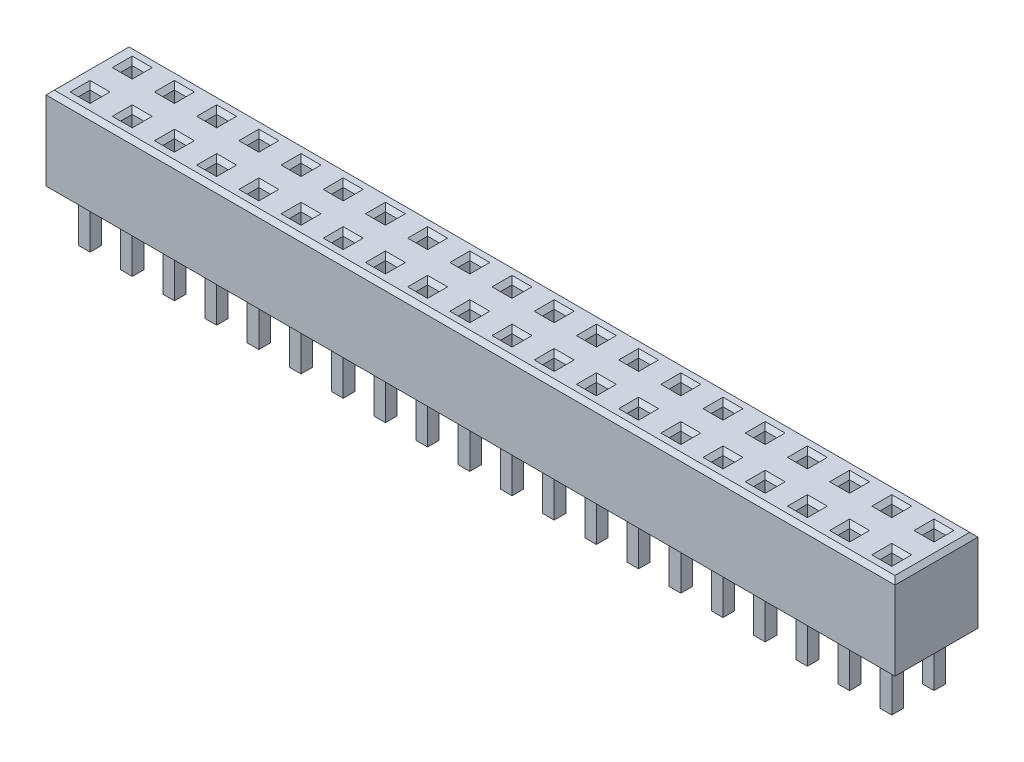
from build123d import *

# Parameters (mm, degrees)
BOSS_EXTRUDE1_DEPTH      = 2.5
BOSS_EXTRUDE1_DEPTH_BACK = 2.5
SKETCH1_W                = 51.1
SKETCH1_H                = 5
SKETCH1_W_2              = 0.7
SKETCH1_H_2              = 0.7
SKETCH2_W                = 0.7
SKETCH2_H                = 0.7
BOSS_EXTRUDE2_DEPTH      = 5.5
BOSS_EXTRUDE2_2_DEPTH    = 5.5
BOSS_EXTRUDE2_3_DEPTH    = 5.5
BOSS_EXTRUDE2_4_DEPTH    = 5.5
BOSS_EXTRUDE2_5_DEPTH    = 5.5
BOSS_EXTRUDE2_6_DEPTH    = 5.5
BOSS_EXTRUDE2_7_DEPTH    = 5.5
BOSS_EXTRUDE2_8_DEPTH    = 5.5
BOSS_EXTRUDE2_9_DEPTH    = 5.5
BOSS_EXTRUDE2_10_DEPTH   = 5.5
BOSS_EXTRUDE2_11_DEPTH   = 5.5
BOSS_EXTRUDE2_12_DEPTH   = 5.5
BOSS_EXTRUDE2_13_DEPTH   = 5.5
BOSS_EXTRUDE2_14_DEPTH   = 5.5
BOSS_EXTRUDE2_15_DEPTH   = 5.5
BOSS_EXTRUDE2_16_DEPTH   = 5.5
BOSS_EXTRUDE2_17_DEPTH   = 5.5
BOSS_EXTRUDE2_18_DEPTH   = 5.5
BOSS_EXTRUDE2_19_DEPTH   = 5.5
BOSS_EXTRUDE2_20_DEPTH   = 5.5
BOSS_EXTRUDE2_21_DEPTH   = 5.5
BOSS_EXTRUDE2_22_DEPTH   = 5.5
BOSS_EXTRUDE2_23_DEPTH   = 5.5
BOSS_EXTRUDE2_24_DEPTH   = 5.5
BOSS_EXTRUDE2_25_DEPTH   = 5.5
BOSS_EXTRUDE2_26_DEPTH   = 5.5
BOSS_EXTRUDE2_27_DEPTH   = 5.5
BOSS_EXTRUDE2_28_DEPTH   = 5.5
BOSS_EXTRUDE2_29_DEPTH   = 5.5
BOSS_EXTRUDE2_30_DEPTH   = 5.5
BOSS_EXTRUDE2_31_DEPTH   = 5.5
BOSS_EXTRUDE2_32_DEPTH   = 5.5
BOSS_EXTRUDE2_33_DEPTH   = 5.5
BOSS_EXTRUDE2_34_DEPTH   = 5.5
BOSS_EXTRUDE2_35_DEPTH   = 5.5
BOSS_EXTRUDE2_36_DEPTH   = 5.5
BOSS_EXTRUDE2_37_DEPTH   = 5.5
BOSS_EXTRUDE2_38_DEPTH   = 5.5
BOSS_EXTRUDE2_39_DEPTH   = 5.5
BOSS_EXTRUDE2_40_DEPTH   = 5.5
CHAMFER2_SIZE            = 0.25


with BuildPart() as part:
    # Sketch1 → Boss-Extrude1 (new, two sides: drawn at the far end of the back side and taken through both)
    with BuildSketch(Plane(origin=(0, 0, 0), x_dir=(1, 0, 0), z_dir=(0, 1, 0)).offset(-BOSS_EXTRUDE1_DEPTH_BACK)):
        Rectangle(SKETCH1_W, SKETCH1_H)
        with Locations((-24.13, 1.27)):
            Rectangle(SKETCH1_W_2, SKETCH1_H_2, mode=Mode.SUBTRACT)
        with Locations((-24.13, -1.27)):
            Rectangle(SKETCH1_W_2, SKETCH1_H_2, mode=Mode.SUBTRACT)
        with Locations((-21.59, 1.27)):
            Rectangle(SKETCH1_W_2, SKETCH1_H_2, mode=Mode.SUBTRACT)
        with Locations((-21.59, -1.27)):
            Rectangle(SKETCH1_W_2, SKETCH1_H_2, mode=Mode.SUBTRACT)
        with Locations((-19.05, 1.27)):
            Rectangle(SKETCH1_W_2, SKETCH1_H_2, mode=Mode.SUBTRACT)
        with Locations((-19.05, -1.27)):
            Rectangle(SKETCH1_W_2, SKETCH1_H_2, mode=Mode.SUBTRACT)
        with Locations((-16.51, 1.27)):
            Rectangle(SKETCH1_W_2, SKETCH1_H_2, mode=Mode.SUBTRACT)
        with Locations((-16.51, -1.27)):
            Rectangle(SKETCH1_W_2, SKETCH1_H_2, mode=Mode.SUBTRACT)
        with Locations((-13.97, 1.27)):
            Rectangle(SKETCH1_W_2, SKETCH1_H_2, mode=Mode.SUBTRACT)
        with Locations((-13.97, -1.27)):
            Rectangle(SKETCH1_W_2, SKETCH1_H_2, mode=Mode.SUBTRACT)
        with Locations((-11.43, 1.27)):
            Rectangle(SKETCH1_W_2, SKETCH1_H_2, mode=Mode.SUBTRACT)
        with Locations((-11.43, -1.27)):
            Rectangle(SKETCH1_W_2, SKETCH1_H_2, mode=Mode.SUBTRACT)
        with Locations((-8.89, 1.27)):
            Rectangle(SKETCH1_W_2, SKETCH1_H_2, mode=Mode.SUBTRACT)
        with Locations((-8.89, -1.27)):
            Rectangle(SKETCH1_W_2, SKETCH1_H_2, mode=Mode.SUBTRACT)
        with Locations((-6.35, 1.27)):
            Rectangle(SKETCH1_W_2, SKETCH1_H_2, mode=Mode.SUBTRACT)
        with Locations((-6.35, -1.27)):
            Rectangle(SKETCH1_W_2, SKETCH1_H_2, mode=Mode.SUBTRACT)
        with Locations((-3.81, 1.27)):
            Rectangle(SKETCH1_W_2, SKETCH1_H_2, mode=Mode.SUBTRACT)
        with Locations((-3.81, -1.27)):
            Rectangle(SKETCH1_W_2, SKETCH1_H_2, mode=Mode.SUBTRACT)
        with Locations((-1.27, 1.27)):
            Rectangle(SKETCH1_W_2, SKETCH1_H_2, mode=Mode.SUBTRACT)
        with Locations((-1.27, -1.27)):
            Rectangle(SKETCH1_W_2, SKETCH1_H_2, mode=Mode.SUBTRACT)
        with Locations((1.27, 1.27)):
            Rectangle(SKETCH1_W_2, SKETCH1_H_2, mode=Mode.SUBTRACT)
        with Locations((1.27, -1.27)):
            Rectangle(SKETCH1_W_2, SKETCH1_H_2, mode=Mode.SUBTRACT)
        with Locations((3.81, 1.27)):
            Rectangle(SKETCH1_W_2, SKETCH1_H_2, mode=Mode.SUBTRACT)
        with Locations((3.81, -1.27)):
            Rectangle(SKETCH1_W_2, SKETCH1_H_2, mode=Mode.SUBTRACT)
        with Locations((6.35, 1.27)):
            Rectangle(SKETCH1_W_2, SKETCH1_H_2, mode=Mode.SUBTRACT)
        with Locations((6.35, -1.27)):
            Rectangle(SKETCH1_W_2, SKETCH1_H_2, mode=Mode.SUBTRACT)
        with Locations((8.89, 1.27)):
            Rectangle(SKETCH1_W_2, SKETCH1_H_2, mode=Mode.SUBTRACT)
        with Locations((8.89, -1.27)):
            Rectangle(SKETCH1_W_2, SKETCH1_H_2, mode=Mode.SUBTRACT)
        with Locations((11.43, 1.27)):
            Rectangle(SKETCH1_W_2, SKETCH1_H_2, mode=Mode.SUBTRACT)
        with Locations((11.43, -1.27)):
            Rectangle(SKETCH1_W_2, SKETCH1_H_2, mode=Mode.SUBTRACT)
        with Locations((13.97, 1.27)):
            Rectangle(SKETCH1_W_2, SKETCH1_H_2, mode=Mode.SUBTRACT)
        with Locations((13.97, -1.27)):
            Rectangle(SKETCH1_W_2, SKETCH1_H_2, mode=Mode.SUBTRACT)
        with Locations((16.51, 1.27)):
            Rectangle(SKETCH1_W_2, SKETCH1_H_2, mode=Mode.SUBTRACT)
        with Locations((16.51, -1.27)):
            Rectangle(SKETCH1_W_2, SKETCH1_H_2, mode=Mode.SUBTRACT)
        with Locations((19.05, 1.27)):
            Rectangle(SKETCH1_W_2, SKETCH1_H_2, mode=Mode.SUBTRACT)
        with Locations((19.05, -1.27)):
            Rectangle(SKETCH1_W_2, SKETCH1_H_2, mode=Mode.SUBTRACT)
        with Locations((21.59, 1.27)):
            Rectangle(SKETCH1_W_2, SKETCH1_H_2, mode=Mode.SUBTRACT)
        with Locations((21.59, -1.27)):
            Rectangle(SKETCH1_W_2, SKETCH1_H_2, mode=Mode.SUBTRACT)
        with Locations((24.13, 1.27)):
            Rectangle(SKETCH1_W_2, SKETCH1_H_2, mode=Mode.SUBTRACT)
        with Locations((24.13, -1.27)):
            Rectangle(SKETCH1_W_2, SKETCH1_H_2, mode=Mode.SUBTRACT)
    extrude(amount=BOSS_EXTRUDE1_DEPTH + BOSS_EXTRUDE1_DEPTH_BACK)

    # Chamfer2
    chamfer2_edges = [part.edges().sort_by_distance(p)[0] for p in [
        (24.13, 2.5, 0.92),
        (23.78, 2.5, 1.27),
        (24.13, 2.5, 1.62),
        (24.48, 2.5, 1.27),
        (21.59, 2.5, 0.92),
        (21.24, 2.5, 1.27),
        (21.59, 2.5, 1.62),
        (21.94, 2.5, 1.27),
        (19.05, 2.5, 0.92),
        (18.7, 2.5, 1.27),
        (19.05, 2.5, 1.62),
        (19.4, 2.5, 1.27),
        (16.51, 2.5, 0.92),
        (16.16, 2.5, 1.27),
        (16.51, 2.5, 1.62),
        (16.86, 2.5, 1.27),
        (13.97, 2.5, 0.92),
        (13.62, 2.5, 1.27),
        (13.97, 2.5, 1.62),
        (14.32, 2.5, 1.27),
        (11.43, 2.5, 0.92),
        (11.08, 2.5, 1.27),
        (11.43, 2.5, 1.62),
        (11.78, 2.5, 1.27),
        (8.89, 2.5, 0.92),
        (8.54, 2.5, 1.27),
        (8.89, 2.5, 1.62),
        (9.24, 2.5, 1.27),
        (6.35, 2.5, 0.92),
        (6, 2.5, 1.27),
        (6.35, 2.5, 1.62),
        (6.7, 2.5, 1.27),
        (3.81, 2.5, 0.92),
        (3.46, 2.5, 1.27),
        (3.81, 2.5, 1.62),
        (4.16, 2.5, 1.27),
        (1.27, 2.5, 0.92),
        (0.92, 2.5, 1.27),
        (1.27, 2.5, 1.62),
        (1.62, 2.5, 1.27),
        (-1.27, 2.5, 0.92),
        (-1.62, 2.5, 1.27),
        (-1.27, 2.5, 1.62),
        (-0.92, 2.5, 1.27),
        (-3.81, 2.5, 0.92),
        (-4.16, 2.5, 1.27),
        (-3.81, 2.5, 1.62),
        (-3.46, 2.5, 1.27),
        (-6.35, 2.5, 0.92),
        (-6.7, 2.5, 1.27),
        (-6.35, 2.5, 1.62),
        (-6, 2.5, 1.27),
        (-8.89, 2.5, 0.92),
        (-9.24, 2.5, 1.27),
        (-8.89, 2.5, 1.62),
        (-8.54, 2.5, 1.27),
        (-11.43, 2.5, 0.92),
        (-11.78, 2.5, 1.27),
        (-11.43, 2.5, 1.62),
        (-11.08, 2.5, 1.27),
        (-13.97, 2.5, 0.92),
        (-14.32, 2.5, 1.27),
        (-13.97, 2.5, 1.62),
        (-13.62, 2.5, 1.27),
        (-16.51, 2.5, 0.92),
        (-16.86, 2.5, 1.27),
        (-16.51, 2.5, 1.62),
        (-16.16, 2.5, 1.27),
        (-19.05, 2.5, 0.92),
        (-19.4, 2.5, 1.27),
        (-19.05, 2.5, 1.62),
        (-18.7, 2.5, 1.27),
        (-21.59, 2.5, 0.92),
        (-21.94, 2.5, 1.27),
        (-21.59, 2.5, 1.62),
        (-21.24, 2.5, 1.27),
        (-24.13, 2.5, 0.92),
        (-24.48, 2.5, 1.27),
        (-24.13, 2.5, 1.62),
        (-23.78, 2.5, 1.27),
        (0, 2.5, 2.5),
        (-25.55, 2.5, 0),
        (0, 2.5, -2.5),
        (25.55, 2.5, 0),
        (-24.13, 2.5, -1.62),
        (-24.48, 2.5, -1.27),
        (-24.13, 2.5, -0.92),
        (-23.78, 2.5, -1.27),
        (-21.24, 2.5, -1.27),
        (-21.59, 2.5, -1.62),
        (-21.94, 2.5, -1.27),
        (-21.59, 2.5, -0.92),
        (-18.7, 2.5, -1.27),
        (-19.05, 2.5, -1.62),
        (-19.4, 2.5, -1.27),
        (-19.05, 2.5, -0.92),
        (-16.16, 2.5, -1.27),
        (-16.51, 2.5, -1.62),
        (-16.86, 2.5, -1.27),
        (-16.51, 2.5, -0.92),
        (-13.62, 2.5, -1.27),
        (-13.97, 2.5, -1.62),
        (-14.32, 2.5, -1.27),
        (-13.97, 2.5, -0.92),
        (-11.08, 2.5, -1.27),
        (-11.43, 2.5, -1.62),
        (-11.78, 2.5, -1.27),
        (-11.43, 2.5, -0.92),
        (-8.54, 2.5, -1.27),
        (-8.89, 2.5, -1.62),
        (-9.24, 2.5, -1.27),
        (-8.89, 2.5, -0.92),
        (-6, 2.5, -1.27),
        (-6.35, 2.5, -1.62),
        (-6.7, 2.5, -1.27),
        (-6.35, 2.5, -0.92),
        (-3.46, 2.5, -1.27),
        (-3.81, 2.5, -1.62),
        (-4.16, 2.5, -1.27),
        (-3.81, 2.5, -0.92),
        (-0.92, 2.5, -1.27),
        (-1.27, 2.5, -1.62),
        (-1.62, 2.5, -1.27),
        (-1.27, 2.5, -0.92),
        (1.62, 2.5, -1.27),
        (1.27, 2.5, -1.62),
        (0.92, 2.5, -1.27),
        (1.27, 2.5, -0.92),
        (4.16, 2.5, -1.27),
        (3.81, 2.5, -1.62),
        (3.46, 2.5, -1.27),
        (3.81, 2.5, -0.92),
        (6.7, 2.5, -1.27),
        (6.35, 2.5, -1.62),
        (6, 2.5, -1.27),
        (6.35, 2.5, -0.92),
        (9.24, 2.5, -1.27),
        (8.89, 2.5, -1.62),
        (8.54, 2.5, -1.27),
        (8.89, 2.5, -0.92),
        (11.78, 2.5, -1.27),
        (11.43, 2.5, -1.62),
        (11.08, 2.5, -1.27),
        (11.43, 2.5, -0.92),
        (14.32, 2.5, -1.27),
        (13.97, 2.5, -1.62),
        (13.62, 2.5, -1.27),
        (13.97, 2.5, -0.92),
        (16.86, 2.5, -1.27),
        (16.51, 2.5, -1.62),
        (16.16, 2.5, -1.27),
        (16.51, 2.5, -0.92),
        (19.4, 2.5, -1.27),
        (19.05, 2.5, -1.62),
        (18.7, 2.5, -1.27),
        (19.05, 2.5, -0.92),
        (21.94, 2.5, -1.27),
        (21.59, 2.5, -1.62),
        (21.24, 2.5, -1.27),
        (21.59, 2.5, -0.92),
        (24.48, 2.5, -1.27),
        (24.13, 2.5, -1.62),
        (23.78, 2.5, -1.27),
        (24.13, 2.5, -0.92),
    ]]
    chamfer(chamfer2_edges, length=CHAMFER2_SIZE)


with BuildPart() as body_2:
    # Sketch2 → Boss-Extrude2 (new body)
    with BuildSketch(Plane(origin=(0, 0, 0), x_dir=(1, 0, 0), z_dir=(0, 1, 0))):
        with Locations((-21.59, 1.27)):
            Rectangle(SKETCH2_W, SKETCH2_H)
    extrude(amount=-BOSS_EXTRUDE2_DEPTH)


with BuildPart() as body_3:
    # Sketch2 → Boss-Extrude2 2 (new body)
    with BuildSketch(Plane(origin=(0, 0, 0), x_dir=(1, 0, 0), z_dir=(0, 1, 0))):
        with Locations((-24.13, 1.27)):
            Rectangle(SKETCH2_W, SKETCH2_H)
    extrude(amount=-BOSS_EXTRUDE2_2_DEPTH)


with BuildPart() as body_4:
    # Sketch2 → Boss-Extrude2 3 (new body)
    with BuildSketch(Plane(origin=(0, 0, 0), x_dir=(1, 0, 0), z_dir=(0, 1, 0))):
        with Locations((-19.05, 1.27)):
            Rectangle(SKETCH2_W, SKETCH2_H)
    extrude(amount=-BOSS_EXTRUDE2_3_DEPTH)


with BuildPart() as body_5:
    # Sketch2 → Boss-Extrude2 4 (new body)
    with BuildSketch(Plane(origin=(0, 0, 0), x_dir=(1, 0, 0), z_dir=(0, 1, 0))):
        with Locations((-16.51, 1.27)):
            Rectangle(SKETCH2_W, SKETCH2_H)
    extrude(amount=-BOSS_EXTRUDE2_4_DEPTH)


with BuildPart() as body_6:
    # Sketch2 → Boss-Extrude2 5 (new body)
    with BuildSketch(Plane(origin=(0, 0, 0), x_dir=(1, 0, 0), z_dir=(0, 1, 0))):
        with Locations((-13.97, 1.27)):
            Rectangle(SKETCH2_W, SKETCH2_H)
    extrude(amount=-BOSS_EXTRUDE2_5_DEPTH)


with BuildPart() as body_7:
    # Sketch2 → Boss-Extrude2 6 (new body)
    with BuildSketch(Plane(origin=(0, 0, 0), x_dir=(1, 0, 0), z_dir=(0, 1, 0))):
        with Locations((-11.43, 1.27)):
            Rectangle(SKETCH2_W, SKETCH2_H)
    extrude(amount=-BOSS_EXTRUDE2_6_DEPTH)


with BuildPart() as body_8:
    # Sketch2 → Boss-Extrude2 7 (new body)
    with BuildSketch(Plane(origin=(0, 0, 0), x_dir=(1, 0, 0), z_dir=(0, 1, 0))):
        with Locations((-8.89, 1.27)):
            Rectangle(SKETCH2_W, SKETCH2_H)
    extrude(amount=-BOSS_EXTRUDE2_7_DEPTH)


with BuildPart() as body_9:
    # Sketch2 → Boss-Extrude2 8 (new body)
    with BuildSketch(Plane(origin=(0, 0, 0), x_dir=(1, 0, 0), z_dir=(0, 1, 0))):
        with Locations((-6.35, 1.27)):
            Rectangle(SKETCH2_W, SKETCH2_H)
    extrude(amount=-BOSS_EXTRUDE2_8_DEPTH)


with BuildPart() as body_10:
    # Sketch2 → Boss-Extrude2 9 (new body)
    with BuildSketch(Plane(origin=(0, 0, 0), x_dir=(1, 0, 0), z_dir=(0, 1, 0))):
        with Locations((-3.81, 1.27)):
            Rectangle(SKETCH2_W, SKETCH2_H)
    extrude(amount=-BOSS_EXTRUDE2_9_DEPTH)


with BuildPart() as body_11:
    # Sketch2 → Boss-Extrude2 10 (new body)
    with BuildSketch(Plane(origin=(0, 0, 0), x_dir=(1, 0, 0), z_dir=(0, 1, 0))):
        with Locations((-1.27, 1.27)):
            Rectangle(SKETCH2_W, SKETCH2_H)
    extrude(amount=-BOSS_EXTRUDE2_10_DEPTH)


with BuildPart() as body_12:
    # Sketch2 → Boss-Extrude2 11 (new body)
    with BuildSketch(Plane(origin=(0, 0, 0), x_dir=(1, 0, 0), z_dir=(0, 1, 0))):
        with Locations((1.27, 1.27)):
            Rectangle(SKETCH2_W, SKETCH2_H)
    extrude(amount=-BOSS_EXTRUDE2_11_DEPTH)


with BuildPart() as body_13:
    # Sketch2 → Boss-Extrude2 12 (new body)
    with BuildSketch(Plane(origin=(0, 0, 0), x_dir=(1, 0, 0), z_dir=(0, 1, 0))):
        with Locations((3.81, 1.27)):
            Rectangle(SKETCH2_W, SKETCH2_H)
    extrude(amount=-BOSS_EXTRUDE2_12_DEPTH)


with BuildPart() as body_14:
    # Sketch2 → Boss-Extrude2 13 (new body)
    with BuildSketch(Plane(origin=(0, 0, 0), x_dir=(1, 0, 0), z_dir=(0, 1, 0))):
        with Locations((6.35, 1.27)):
            Rectangle(SKETCH2_W, SKETCH2_H)
    extrude(amount=-BOSS_EXTRUDE2_13_DEPTH)


with BuildPart() as body_15:
    # Sketch2 → Boss-Extrude2 14 (new body)
    with BuildSketch(Plane(origin=(0, 0, 0), x_dir=(1, 0, 0), z_dir=(0, 1, 0))):
        with Locations((8.89, 1.27)):
            Rectangle(SKETCH2_W, SKETCH2_H)
    extrude(amount=-BOSS_EXTRUDE2_14_DEPTH)


with BuildPart() as body_16:
    # Sketch2 → Boss-Extrude2 15 (new body)
    with BuildSketch(Plane(origin=(0, 0, 0), x_dir=(1, 0, 0), z_dir=(0, 1, 0))):
        with Locations((11.43, 1.27)):
            Rectangle(SKETCH2_W, SKETCH2_H)
    extrude(amount=-BOSS_EXTRUDE2_15_DEPTH)


with BuildPart() as body_17:
    # Sketch2 → Boss-Extrude2 16 (new body)
    with BuildSketch(Plane(origin=(0, 0, 0), x_dir=(1, 0, 0), z_dir=(0, 1, 0))):
        with Locations((13.97, 1.27)):
            Rectangle(SKETCH2_W, SKETCH2_H)
    extrude(amount=-BOSS_EXTRUDE2_16_DEPTH)


with BuildPart() as body_18:
    # Sketch2 → Boss-Extrude2 17 (new body)
    with BuildSketch(Plane(origin=(0, 0, 0), x_dir=(1, 0, 0), z_dir=(0, 1, 0))):
        with Locations((16.51, 1.27)):
            Rectangle(SKETCH2_W, SKETCH2_H)
    extrude(amount=-BOSS_EXTRUDE2_17_DEPTH)


with BuildPart() as body_19:
    # Sketch2 → Boss-Extrude2 18 (new body)
    with BuildSketch(Plane(origin=(0, 0, 0), x_dir=(1, 0, 0), z_dir=(0, 1, 0))):
        with Locations((19.05, 1.27)):
            Rectangle(SKETCH2_W, SKETCH2_H)
    extrude(amount=-BOSS_EXTRUDE2_18_DEPTH)


with BuildPart() as body_20:
    # Sketch2 → Boss-Extrude2 19 (new body)
    with BuildSketch(Plane(origin=(0, 0, 0), x_dir=(1, 0, 0), z_dir=(0, 1, 0))):
        with Locations((21.59, 1.27)):
            Rectangle(SKETCH2_W, SKETCH2_H)
    extrude(amount=-BOSS_EXTRUDE2_19_DEPTH)


with BuildPart() as body_21:
    # Sketch2 → Boss-Extrude2 20 (new body)
    with BuildSketch(Plane(origin=(0, 0, 0), x_dir=(1, 0, 0), z_dir=(0, 1, 0))):
        with Locations((24.13, 1.27)):
            Rectangle(SKETCH2_W, SKETCH2_H)
    extrude(amount=-BOSS_EXTRUDE2_20_DEPTH)


with BuildPart() as body_22:
    # Sketch2 → Boss-Extrude2 21 (new body)
    with BuildSketch(Plane(origin=(0, 0, 0), x_dir=(1, 0, 0), z_dir=(0, 1, 0))):
        with Locations((-21.59, -1.27)):
            Rectangle(SKETCH2_W, SKETCH2_H)
    extrude(amount=-BOSS_EXTRUDE2_21_DEPTH)


with BuildPart() as body_23:
    # Sketch2 → Boss-Extrude2 22 (new body)
    with BuildSketch(Plane(origin=(0, 0, 0), x_dir=(1, 0, 0), z_dir=(0, 1, 0))):
        with Locations((-19.05, -1.27)):
            Rectangle(SKETCH2_W, SKETCH2_H)
    extrude(amount=-BOSS_EXTRUDE2_22_DEPTH)


with BuildPart() as body_24:
    # Sketch2 → Boss-Extrude2 23 (new body)
    with BuildSketch(Plane(origin=(0, 0, 0), x_dir=(1, 0, 0), z_dir=(0, 1, 0))):
        with Locations((-16.51, -1.27)):
            Rectangle(SKETCH2_W, SKETCH2_H)
    extrude(amount=-BOSS_EXTRUDE2_23_DEPTH)


with BuildPart() as body_25:
    # Sketch2 → Boss-Extrude2 24 (new body)
    with BuildSketch(Plane(origin=(0, 0, 0), x_dir=(1, 0, 0), z_dir=(0, 1, 0))):
        with Locations((-13.97, -1.27)):
            Rectangle(SKETCH2_W, SKETCH2_H)
    extrude(amount=-BOSS_EXTRUDE2_24_DEPTH)


with BuildPart() as body_26:
    # Sketch2 → Boss-Extrude2 25 (new body)
    with BuildSketch(Plane(origin=(0, 0, 0), x_dir=(1, 0, 0), z_dir=(0, 1, 0))):
        with Locations((-11.43, -1.27)):
            Rectangle(SKETCH2_W, SKETCH2_H)
    extrude(amount=-BOSS_EXTRUDE2_25_DEPTH)


with BuildPart() as body_27:
    # Sketch2 → Boss-Extrude2 26 (new body)
    with BuildSketch(Plane(origin=(0, 0, 0), x_dir=(1, 0, 0), z_dir=(0, 1, 0))):
        with Locations((-8.89, -1.27)):
            Rectangle(SKETCH2_W, SKETCH2_H)
    extrude(amount=-BOSS_EXTRUDE2_26_DEPTH)


with BuildPart() as body_28:
    # Sketch2 → Boss-Extrude2 27 (new body)
    with BuildSketch(Plane(origin=(0, 0, 0), x_dir=(1, 0, 0), z_dir=(0, 1, 0))):
        with Locations((-6.35, -1.27)):
            Rectangle(SKETCH2_W, SKETCH2_H)
    extrude(amount=-BOSS_EXTRUDE2_27_DEPTH)


with BuildPart() as body_29:
    # Sketch2 → Boss-Extrude2 28 (new body)
    with BuildSketch(Plane(origin=(0, 0, 0), x_dir=(1, 0, 0), z_dir=(0, 1, 0))):
        with Locations((-3.81, -1.27)):
            Rectangle(SKETCH2_W, SKETCH2_H)
    extrude(amount=-BOSS_EXTRUDE2_28_DEPTH)


with BuildPart() as body_30:
    # Sketch2 → Boss-Extrude2 29 (new body)
    with BuildSketch(Plane(origin=(0, 0, 0), x_dir=(1, 0, 0), z_dir=(0, 1, 0))):
        with Locations((-1.27, -1.27)):
            Rectangle(SKETCH2_W, SKETCH2_H)
    extrude(amount=-BOSS_EXTRUDE2_29_DEPTH)


with BuildPart() as body_31:
    # Sketch2 → Boss-Extrude2 30 (new body)
    with BuildSketch(Plane(origin=(0, 0, 0), x_dir=(1, 0, 0), z_dir=(0, 1, 0))):
        with Locations((1.27, -1.27)):
            Rectangle(SKETCH2_W, SKETCH2_H)
    extrude(amount=-BOSS_EXTRUDE2_30_DEPTH)


with BuildPart() as body_32:
    # Sketch2 → Boss-Extrude2 31 (new body)
    with BuildSketch(Plane(origin=(0, 0, 0), x_dir=(1, 0, 0), z_dir=(0, 1, 0))):
        with Locations((3.81, -1.27)):
            Rectangle(SKETCH2_W, SKETCH2_H)
    extrude(amount=-BOSS_EXTRUDE2_31_DEPTH)


with BuildPart() as body_33:
    # Sketch2 → Boss-Extrude2 32 (new body)
    with BuildSketch(Plane(origin=(0, 0, 0), x_dir=(1, 0, 0), z_dir=(0, 1, 0))):
        with Locations((6.35, -1.27)):
            Rectangle(SKETCH2_W, SKETCH2_H)
    extrude(amount=-BOSS_EXTRUDE2_32_DEPTH)


with BuildPart() as body_34:
    # Sketch2 → Boss-Extrude2 33 (new body)
    with BuildSketch(Plane(origin=(0, 0, 0), x_dir=(1, 0, 0), z_dir=(0, 1, 0))):
        with Locations((8.89, -1.27)):
            Rectangle(SKETCH2_W, SKETCH2_H)
    extrude(amount=-BOSS_EXTRUDE2_33_DEPTH)


with BuildPart() as body_35:
    # Sketch2 → Boss-Extrude2 34 (new body)
    with BuildSketch(Plane(origin=(0, 0, 0), x_dir=(1, 0, 0), z_dir=(0, 1, 0))):
        with Locations((11.43, -1.27)):
            Rectangle(SKETCH2_W, SKETCH2_H)
    extrude(amount=-BOSS_EXTRUDE2_34_DEPTH)


with BuildPart() as body_36:
    # Sketch2 → Boss-Extrude2 35 (new body)
    with BuildSketch(Plane(origin=(0, 0, 0), x_dir=(1, 0, 0), z_dir=(0, 1, 0))):
        with Locations((13.97, -1.27)):
            Rectangle(SKETCH2_W, SKETCH2_H)
    extrude(amount=-BOSS_EXTRUDE2_35_DEPTH)


with BuildPart() as body_37:
    # Sketch2 → Boss-Extrude2 36 (new body)
    with BuildSketch(Plane(origin=(0, 0, 0), x_dir=(1, 0, 0), z_dir=(0, 1, 0))):
        with Locations((16.51, -1.27)):
            Rectangle(SKETCH2_W, SKETCH2_H)
    extrude(amount=-BOSS_EXTRUDE2_36_DEPTH)


with BuildPart() as body_38:
    # Sketch2 → Boss-Extrude2 37 (new body)
    with BuildSketch(Plane(origin=(0, 0, 0), x_dir=(1, 0, 0), z_dir=(0, 1, 0))):
        with Locations((19.05, -1.27)):
            Rectangle(SKETCH2_W, SKETCH2_H)
    extrude(amount=-BOSS_EXTRUDE2_37_DEPTH)


with BuildPart() as body_39:
    # Sketch2 → Boss-Extrude2 38 (new body)
    with BuildSketch(Plane(origin=(0, 0, 0), x_dir=(1, 0, 0), z_dir=(0, 1, 0))):
        with Locations((21.59, -1.27)):
            Rectangle(SKETCH2_W, SKETCH2_H)
    extrude(amount=-BOSS_EXTRUDE2_38_DEPTH)


with BuildPart() as body_40:
    # Sketch2 → Boss-Extrude2 39 (new body)
    with BuildSketch(Plane(origin=(0, 0, 0), x_dir=(1, 0, 0), z_dir=(0, 1, 0))):
        with Locations((24.13, -1.27)):
            Rectangle(SKETCH2_W, SKETCH2_H)
    extrude(amount=-BOSS_EXTRUDE2_39_DEPTH)


with BuildPart() as body_41:
    # Sketch2 → Boss-Extrude2 40 (new body)
    with BuildSketch(Plane(origin=(0, 0, 0), x_dir=(1, 0, 0), z_dir=(0, 1, 0))):
        with Locations((-24.13, -1.27)):
            Rectangle(SKETCH2_W, SKETCH2_H)
    extrude(amount=-BOSS_EXTRUDE2_40_DEPTH)


solid = Compound([part.part, body_2.part, body_3.part, body_4.part, body_5.part, body_6.part, body_7.part, body_8.part, body_9.part, body_10.part, body_11.part, body_12.part, body_13.part, body_14.part, body_15.part, body_16.part, body_17.part, body_18.part, body_19.part, body_20.part, body_21.part, body_22.part, body_23.part, body_24.part, body_25.part, body_26.part, body_27.part, body_28.part, body_29.part, body_30.part, body_31.part, body_32.part, body_33.part, body_34.part, body_35.part, body_36.part, body_37.part, body_38.part, body_39.part, body_40.part, body_41.part])
